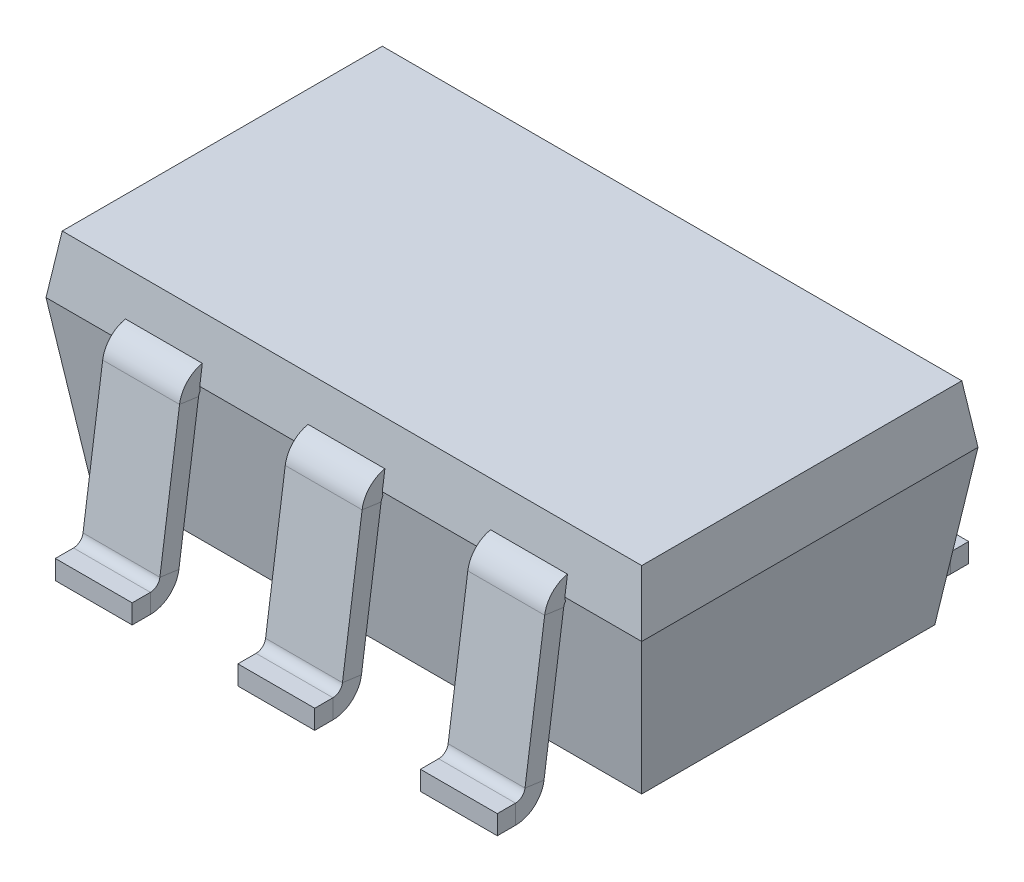
from build123d import *

# Parameters (mm, degrees)
SKETCH1_W                     = 3.1
SKETCH1_H                     = 1.75
BOSS_EXTRUDE1_DEPTH           = 0.3
BOSS_EXTRUDE1_TAPER           = 8
BOSS_EXTRUDE1_OTHER_WAY_DEPTH = 0.8
BOSS_EXTRUDE1_OTHER_WAY_TAPER = 8
BASE_FLANGE2_DEPTH            = 0.2
LPATTERN1_COUNT               = 2
LPATTERN1_PITCH               = 0.95
LPATTERN1_2_COUNT             = 2
LPATTERN1_2_PITCH             = 0.95


# Sheet-metal steps are written as plain solids
with BuildPart() as part:
    # Sketch1 → Boss-Extrude1 (new body)
    with BuildSketch(Plane(origin=(0, 0, 0), x_dir=(1, 0, 0), z_dir=(0, 1, 0))):
        Rectangle(SKETCH1_W, SKETCH1_H)
    extrude(amount=BOSS_EXTRUDE1_DEPTH, taper=BOSS_EXTRUDE1_TAPER)

    # Sketch1 → Boss-Extrude1 other way (add)
    with BuildSketch(Plane(origin=(0, 0, 0), x_dir=(1, 0, 0), z_dir=(0, 1, 0))):
        Rectangle(SKETCH1_W, SKETCH1_H)
    extrude(amount=-BOSS_EXTRUDE1_OTHER_WAY_DEPTH, taper=BOSS_EXTRUDE1_OTHER_WAY_TAPER)


with BuildPart() as body_2:
    # Sketch2 → Base-Flange2 (new, symmetric)
    with BuildSketch(Plane.ZY):
        with BuildLine():
            Line((0.675, 0), (0.831535663, 0))
            ThreePointArc((0.831535663, 0), (0.864338615, -0.012264521), (0.881049067, -0.043041345))
            Line((0.881049067, -0.043041345), (0.983339552, -0.770875965))
            ThreePointArc((0.983339552, -0.770875965), (1.033470908, -0.863206437), (1.131879762, -0.9))
            Line((1.131879762, -0.9), (1.226486751, -0.9))
            Line((1.226486751, -0.9), (1.226486751, -0.8))
            Line((1.226486751, -0.8), (1.131879762, -0.8))
            ThreePointArc((1.131879762, -0.8), (1.09907681, -0.787735479), (1.082366358, -0.756958655))
            Line((1.082366358, -0.756958655), (0.980075873, -0.029124035))
            ThreePointArc((0.980075873, -0.029124035), (0.929944517, 0.063206437), (0.831535663, 0.1))
            Line((0.831535663, 0.1), (0.675, 0.1))
            Line((0.675, 0.1), (0.675, 0))
        make_face()
    extrude(amount=BASE_FLANGE2_DEPTH, both=True)


with BuildPart() as lpattern1_1:
    # LPattern1: pattern copy
    add(body_2.part.moved(Location(Vector(1, 0, 0) * (1 * LPATTERN1_PITCH))))


with BuildPart() as lpattern1_2_1:
    # LPattern1 2: pattern copy
    add(body_2.part.moved(Location(Vector(-1, 0, 0) * (1 * LPATTERN1_2_PITCH))))


with BuildPart() as body_5:
    # Mirror1: mirrored copy
    add(lpattern1_2_1.part.mirror(Plane(origin=(0, 0, 0), x_dir=(1, 0, 0), z_dir=(0, 0, -1))))


with BuildPart() as body_6:
    # Mirror1 2: mirrored copy
    add(body_2.part.mirror(Plane(origin=(0, 0, 0), x_dir=(1, 0, 0), z_dir=(0, 0, -1))))


with BuildPart() as body_7:
    # Mirror1 3: mirrored copy
    add(lpattern1_1.part.mirror(Plane(origin=(0, 0, 0), x_dir=(1, 0, 0), z_dir=(0, 0, -1))))


solid = Compound([part.part, body_2.part, lpattern1_1.part, lpattern1_2_1.part, body_5.part, body_6.part, body_7.part])
